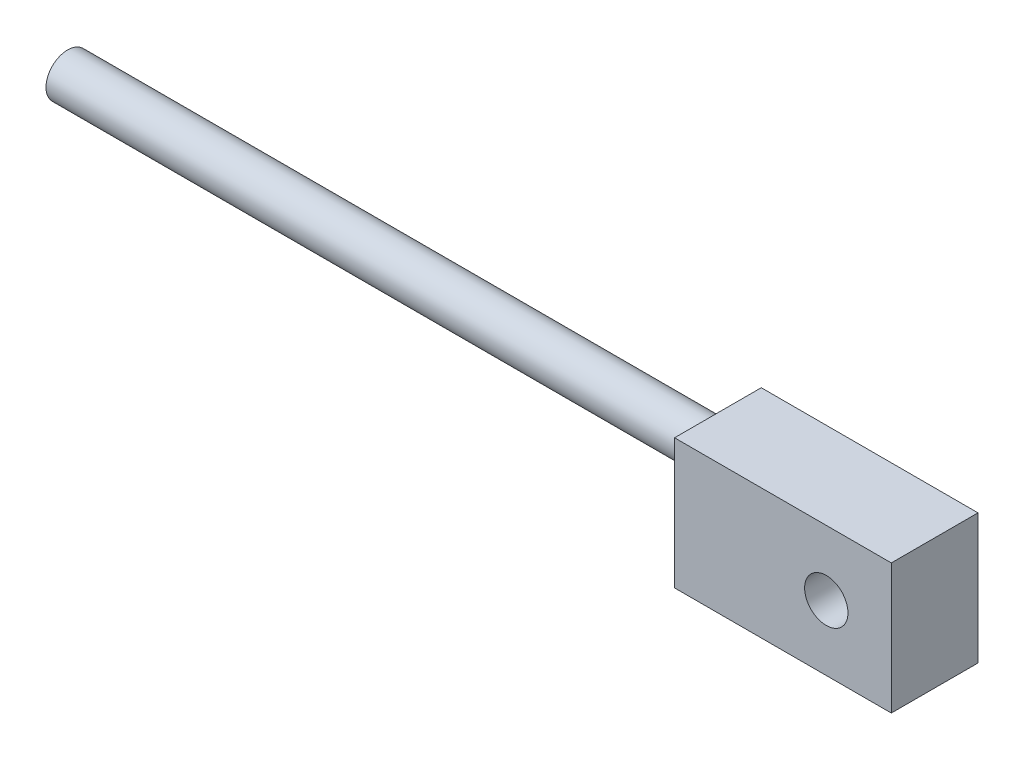
from build123d import *

# Parameters (mm, degrees)
EXTRUDE_1_DEPTH      = 20
EXTRUDE_1_DEPTH_BACK = 20
SKETCH_1_W           = 100
SKETCH_1_H           = 60
SKETCH_1_R           = 10
SKETCH_2_R           = 10
EXTRUDE_2_DEPTH      = 300


with BuildPart() as part:
    # Эскиз1 → Бобышка-Вытянуть1 (new, two sides: drawn at the far end of the back side and taken through both)
    with BuildSketch(Plane.XY.offset(-EXTRUDE_1_DEPTH_BACK)):
        with Locations((-20, 0)):
            Rectangle(SKETCH_1_W, SKETCH_1_H)
        Circle(SKETCH_1_R, mode=Mode.SUBTRACT)
    extrude(amount=EXTRUDE_1_DEPTH + EXTRUDE_1_DEPTH_BACK)

    # Эскиз2 → Бобышка-Вытянуть2 (add)
    with BuildSketch(Plane.ZY.offset(70)):
        with Locations((0, 15)):
            Circle(SKETCH_2_R)
    extrude(amount=EXTRUDE_2_DEPTH)


solid = part.part
